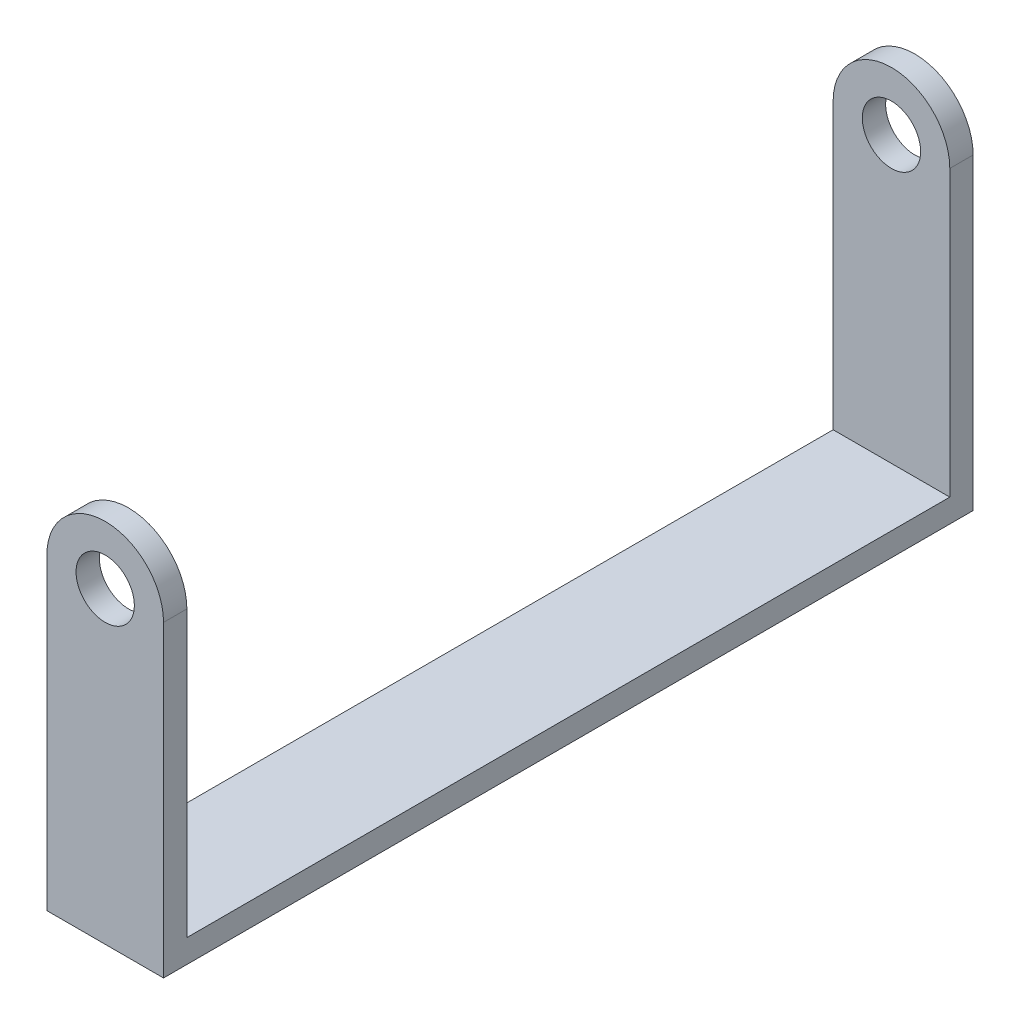
from build123d import *

# Parameters (mm, degrees)
SKETCH1_R           = 3.175
BOSS_EXTRUDE1_DEPTH = 2.54
SKETCH3_W           = 12.7
SKETCH3_H           = 44.069
BOSS_EXTRUDE2_DEPTH = 2.54


with BuildPart() as part:
    # Sketch1 → Boss-Extrude1 (new body)
    with BuildSketch(Plane.XY):
        with BuildLine():
            Line((-6.35, 0), (-6.35, -30.988))
            Line((-6.35, -30.988), (6.35, -30.988))
            Line((6.35, -30.988), (6.35, 0))
            ThreePointArc((6.35, 0), (0, 6.35), (-6.35, 0))
        make_face()
        Circle(SKETCH1_R, mode=Mode.SUBTRACT)
    extrude(amount=BOSS_EXTRUDE1_DEPTH)

    # Sketch3 → Boss-Extrude2 (add)
    with BuildSketch(Plane.XZ.offset(30.988)):
        with Locations((0, 22.0345)):
            Rectangle(SKETCH3_W, SKETCH3_H)
    extrude(amount=BOSS_EXTRUDE2_DEPTH)

    # Mirror3: part across plane


with BuildPart() as part_1:
    add(part.part)
    add(part.part.mirror(Plane(origin=(-6.35, -33.528, 44.069), x_dir=(1, 0, 0), z_dir=(0, 0, -1))))


solid = part_1.part
